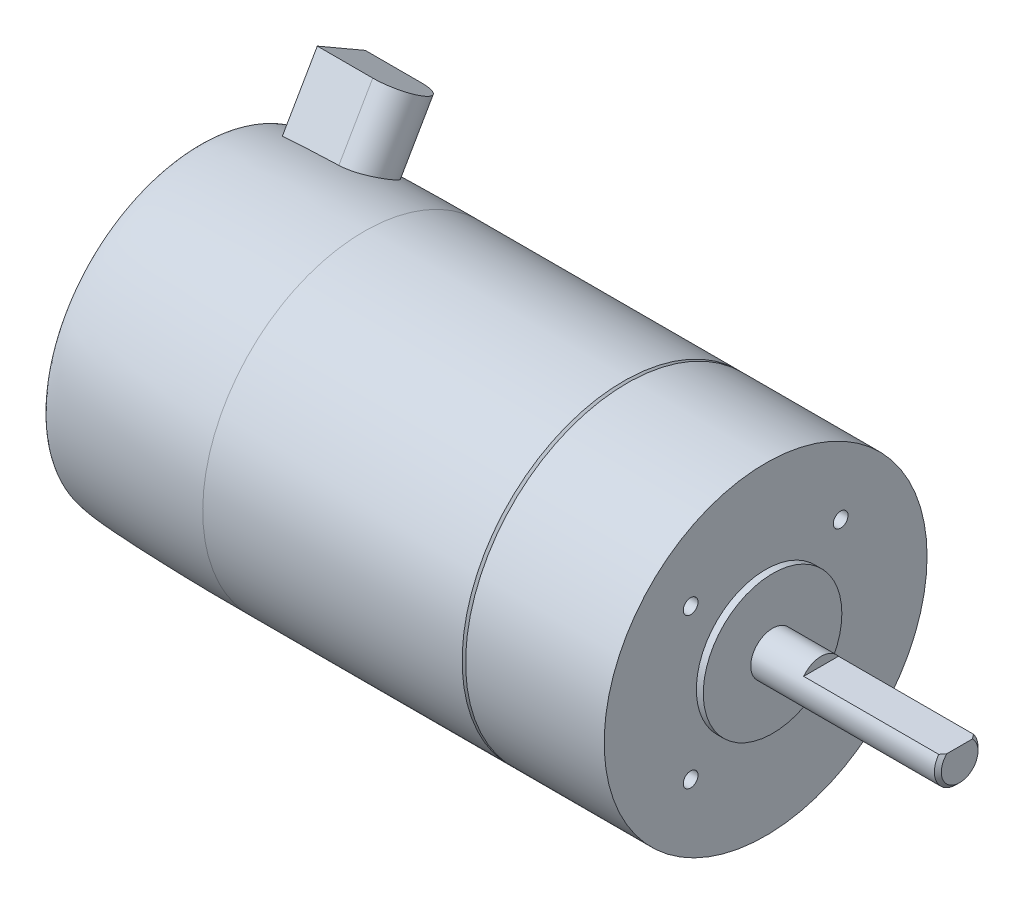
from build123d import *

# Parameters (mm, degrees)
FILLET1_SIZE                   = 1.27
FILLET1_SIZE_2                 = 29.972
SKETCH3_W                      = 6.381173482
SKETCH3_H                      = 3.175
CUT_EXTRUDE1_DEPTH             = 25.4
F_6_32_TAPPED_HOLE2_AT_2_COUNT = 2
F_6_32_TAPPED_HOLE2_AT_2_PITCH = 27.497544243
F_6_32_TAPPED_HOLE2_AT_3_COUNT = 2
F_6_32_TAPPED_HOLE2_AT_3_PITCH = 38.8874
F_6_32_TAPPED_HOLE2_AT_4_COUNT = 2
F_6_32_TAPPED_HOLE2_AT_4_PITCH = 27.497544243
F_6_32_TAPPED_HOLE1_AT_2_COUNT = 2
F_6_32_TAPPED_HOLE1_AT_2_PITCH = 46.0248
F_6_32_TAPPED_HOLE1_AT_3_COUNT = 2
F_6_32_TAPPED_HOLE1_AT_3_PITCH = 39.2684
F_6_32_TAPPED_HOLE1_AT_4_COUNT = 2
F_6_32_TAPPED_HOLE1_AT_4_PITCH = 6.7564
BOSS_EXTRUDE1_DEPTH            = 41.402


with BuildPart() as part:
    # Sketch2 → Revolve1 (revolve)
    with BuildSketch(Plane.XY, mode=Mode.PRIVATE) as revolve1_sk:
        Polygon((35.56, 0), (-116.2558, 0), (-116.2558, 4), (-103.5558, 4), (-103.5558, 29.591), (-26.035, 29.591), (-25.4, 28.956), (-25.4, 29.591), (0, 29.591), (0, 12.7), (1.27, 12.7), (1.27, 4), (34.925, 4), (35.56, 3.365), align=None)
    revolve(revolve1_sk.sketch.rotate(Axis((88.99, 0, 0), (-1, 0, 0)), 90), axis=Axis((88.99, 0, 0), (-1, 0, 0)))

    # Fillet1
    # an asymmetric fillet: 29.972, 1.27 mm, written as the material it takes off along each edge
    with BuildSketch(Plane(origin=(-103.5558, 0, 0), x_dir=(0, 0, -1), z_dir=(0, 1, 0))) as fillet1_piece_1:
        with BuildLine():
            Bezier((29.591 - FILLET1_SIZE, 0), (29.591, 0), (29.591, -FILLET1_SIZE_2), weights=[1, 0.707106781, 1])
            Line((29.591, -FILLET1_SIZE_2), (29.591, 0))
            Line((29.591, 0), (29.591 - FILLET1_SIZE, 0))
        make_face()
    revolve(axis=Axis((-103.5558, 0, 0), (-1, 0, 0)), mode=Mode.SUBTRACT)

    # Sketch3 → Cut-Extrude1 (cut)
    with BuildSketch(Plane(origin=(35.56, 0, 0), x_dir=(0, 0, -1), z_dir=(1, 0, 0))):
        with Locations((0, 4)):
            Rectangle(SKETCH3_W, SKETCH3_H)
    extrude(amount=-CUT_EXTRUDE1_DEPTH, mode=Mode.SUBTRACT)

    # Sketch8 → #6-32 Tapped Hole2 (revolve, cut)
    with BuildSketch(Plane(origin=(0, 13.748772121, 13.748772121), x_dir=(0, 0, -1), z_dir=(0, 1, 0))):
        Polygon((0, 0), (0, 8.81270343), (1.35255, 8.0000094), (1.35255, 0), align=None)
    f_6_32_tapped_hole2 = revolve(axis=Axis((6.35, 13.748772121, 13.748772121), (-1, 0, 0)), mode=Mode.SUBTRACT)

    # #6-32 Tapped Hole2 at 2: #6-32 Tapped Hole2 ×2
    with Locations(*[(0, 0, -i * F_6_32_TAPPED_HOLE2_AT_2_PITCH) for i in range(1, F_6_32_TAPPED_HOLE2_AT_2_COUNT)]):
        add(f_6_32_tapped_hole2, mode=Mode.SUBTRACT)

    # #6-32 Tapped Hole2 at 3: #6-32 Tapped Hole2 ×2
    with Locations(*[Vector(0, -0.7071067811865461, -0.7071067811865489) * (i * F_6_32_TAPPED_HOLE2_AT_3_PITCH) for i in range(1, F_6_32_TAPPED_HOLE2_AT_3_COUNT)]):
        add(f_6_32_tapped_hole2, mode=Mode.SUBTRACT)

    # #6-32 Tapped Hole2 at 4: #6-32 Tapped Hole2 ×2
    with Locations(*[(0, -i * F_6_32_TAPPED_HOLE2_AT_4_PITCH, 0) for i in range(1, F_6_32_TAPPED_HOLE2_AT_4_COUNT)]):
        add(f_6_32_tapped_hole2, mode=Mode.SUBTRACT)

    # Sketch7 → #6-32 Tapped Hole1 (revolve, cut)
    with BuildSketch(Plane(origin=(-103.5558, -19.929323002, -11.5062), x_dir=(0, 0, 1), z_dir=(0, 1, 0))):
        Polygon((0, 0), (0, 10.21069403), (1.35255, 9.398), (1.35255, 0), align=None)
    f_6_32_tapped_hole1 = revolve(axis=Axis((-109.9058, -19.929323002, -11.5062), (1, 0, 0)), mode=Mode.SUBTRACT)

    # #6-32 Tapped Hole1 at 2: #6-32 Tapped Hole1 ×2
    with Locations(*[Vector(0, 0.8660254037844364, 0.5000000000000039) * (i * F_6_32_TAPPED_HOLE1_AT_2_PITCH) for i in range(1, F_6_32_TAPPED_HOLE1_AT_2_COUNT)]):
        add(f_6_32_tapped_hole1, mode=Mode.SUBTRACT)

    # #6-32 Tapped Hole1 at 3: #6-32 Tapped Hole1 ×2
    with Locations(*[Vector(0, 0.8660254037844366, 0.5000000000000038) * (i * F_6_32_TAPPED_HOLE1_AT_3_PITCH) for i in range(1, F_6_32_TAPPED_HOLE1_AT_3_COUNT)]):
        add(f_6_32_tapped_hole1, mode=Mode.SUBTRACT)

    # #6-32 Tapped Hole1 at 4: #6-32 Tapped Hole1 ×2
    with Locations(*[Vector(0, 0.8660254037844365, 0.5000000000000039) * (i * F_6_32_TAPPED_HOLE1_AT_4_PITCH) for i in range(1, F_6_32_TAPPED_HOLE1_AT_4_COUNT)]):
        add(f_6_32_tapped_hole1, mode=Mode.SUBTRACT)

    # Sketch12 → Boss-Extrude1 (add)
    with BuildSketch(Plane(origin=(0, 0, 0), x_dir=(1, 0, 0), z_dir=(0, 0.866025403784438, -0.500000000000001))):
        with BuildLine():
            Line((-98.4758, -5.08), (-88.3158, -5.08))
            ThreePointArc((-88.3158, -5.08), (-83.2358, 0), (-88.3158, 5.08))
            Line((-88.3158, 5.08), (-98.4758, 5.08))
            Line((-98.4758, 5.08), (-98.4758, -5.08))
        make_face()
    extrude(amount=BOSS_EXTRUDE1_DEPTH)


solid = part.part
